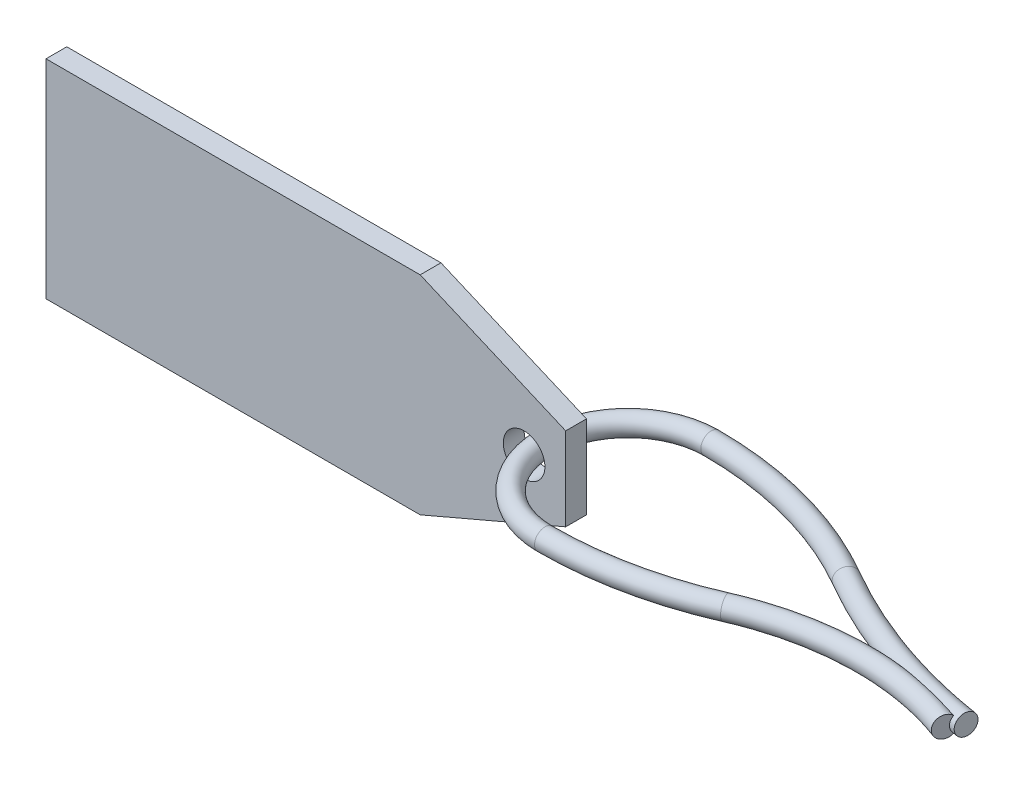
from build123d import *

# Parameters (mm, degrees)
BOSS_EXTRUDE1_DEPTH = 0.05
SKETCH2_R           = 0.05
CUT_EXTRUDE1_DEPTH  = 2.275735082
SWEEP5_OUTLINE_R    = 0.025
SWEEP5_ANGLE        = 44.018601
SWEEP5_2_OUTLINE_R  = 0.025
SWEEP5_2_ANGLE      = 23.592683
SWEEP5_3_OUTLINE_R  = 0.025
SWEEP5_3_ANGLE      = 180
SWEEP5_4_OUTLINE_R  = 0.025
SWEEP5_4_ANGLE      = 30.182755
SWEEP5_5_OUTLINE_R  = 0.025
SWEEP5_5_ANGLE      = 21.084851


with BuildPart() as part:
    # Sketch1 → Boss-Extrude1 (new body)
    with BuildSketch(Plane.XY):
        Polygon((0, -0.25), (0, 0.25), (0.9, 0.25), (1.25, 0.1), (1.25, -0.1), (0.9, -0.25), align=None)
    extrude(amount=BOSS_EXTRUDE1_DEPTH)

    # Sketch2 → Cut-Extrude1 (cut, through all)
    with BuildSketch(Plane.XY.offset(0.05)):
        with Locations((1.15, 0)):
            Circle(SKETCH2_R)
    extrude(amount=-CUT_EXTRUDE1_DEPTH, mode=Mode.SUBTRACT)


with BuildPart() as body_2:
    # Sweep5: read off the stored shape, not the designer's step
    # Sweep5 outline → Sweep5 (revolve)
    with BuildSketch(Plane(origin=(1.983644538, 0, 0.750853873), x_dir=(0.3489959997719201, 0, -0.9371242138282405), z_dir=(0.9371242138282405, 0, 0.3489959997719201))):
        with Locations((0.683186889, 0)):
            Circle(SWEEP5_OUTLINE_R)
    revolve(axis=Axis((1.983644538, 0, 0.750853873), (0, 1, 0)), revolution_arc=SWEEP5_ANGLE)

    # Sweep5 2 outline → Sweep5 2 (revolve)
    with BuildSketch(Plane(origin=(1.35, 0, -0.700006175), x_dir=(0, 0, 1), z_dir=(-1, 0, 0))):
        with Locations((0.900006175, 0)):
            Circle(SWEEP5_2_OUTLINE_R)
    revolve(axis=Axis((1.35, 0, -0.700006175), (0, 1, 0)), revolution_arc=SWEEP5_2_ANGLE)

    # Sweep5 3 outline → Sweep5 3 (revolve)
    with BuildSketch(Plane(origin=(1.35, 0, 0), x_dir=(0, 0, -1), z_dir=(1, 0, 0))):
        with Locations((0.2, 0)):
            Circle(SWEEP5_3_OUTLINE_R)
    revolve(axis=Axis((1.35, 0, 0), (0, 1, 0)), revolution_arc=SWEEP5_3_ANGLE)

    # Sweep5 4 outline → Sweep5 4 (revolve)
    with BuildSketch(Plane(origin=(1.35, 0, 0.685324543), x_dir=(0.5027597968291189, 0, -0.8644261603470497), z_dir=(0.8644261603470497, 0, 0.5027597968291189))):
        with Locations((0.885324543, 0)):
            Circle(SWEEP5_4_OUTLINE_R)
    revolve(axis=Axis((1.35, 0, 0.685324543), (0, 1, 0)), revolution_arc=SWEEP5_4_ANGLE)

    # Sweep5 5 outline → Sweep5 5 (revolve)
    with BuildSketch(Plane(origin=(2.448323774, 0, -1.203091772), x_dir=(-0.502759796829121, 0, 0.8644261603470483), z_dir=(-0.8644261603470483, 0, -0.502759796829121))):
        with Locations((1.299264959, 0)):
            Circle(SWEEP5_5_OUTLINE_R)
    revolve(axis=Axis((2.448323774, 0, -1.203091772), (0, 1, 0)), revolution_arc=SWEEP5_5_ANGLE)


solid = Compound([part.part, body_2.part])
